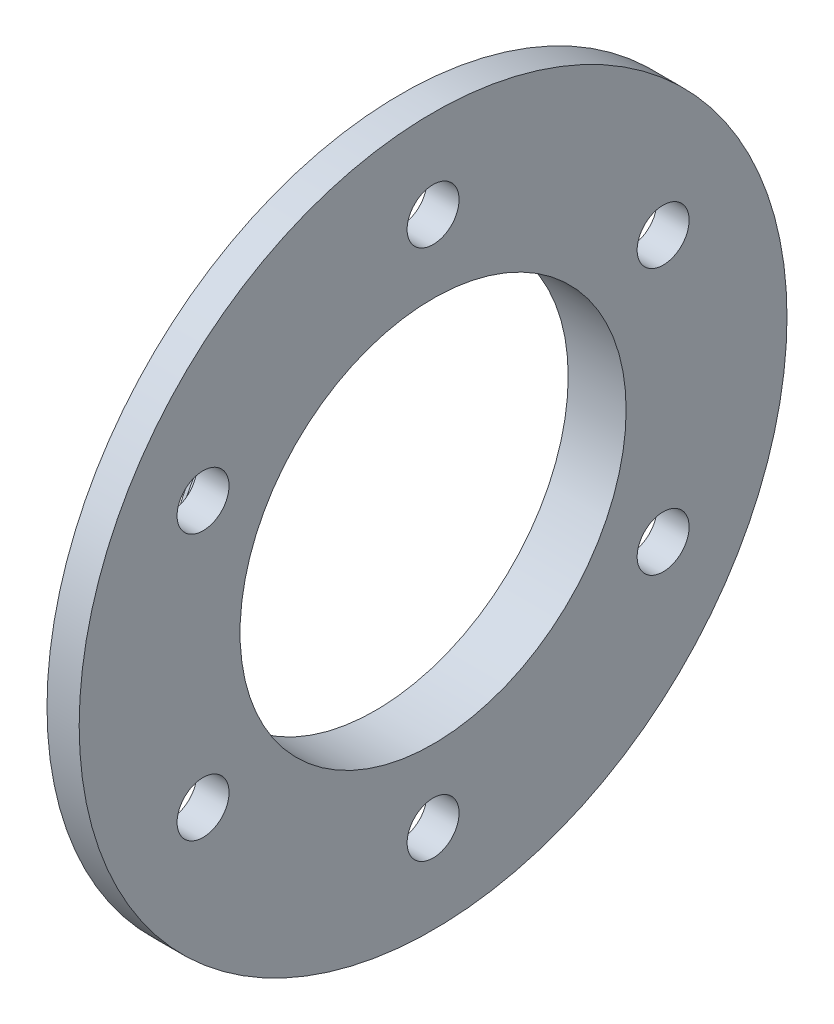
from build123d import *

# Parameters (mm, degrees)
SKETCH1_R           = 27.5
SKETCH1_R_2         = 2.0193
BOSS_EXTRUDE1_DEPTH = 2.5
SKETCH2_R           = 17.46
BOSS_EXTRUDE2_DEPTH = 2
CHAMFER5_SIZE       = 1
SKETCH6_R           = 15
CUT_EXTRUDE1_DEPTH  = 10


with BuildPart() as part:
    # Sketch1 → Boss-Extrude1 (new body)
    with BuildSketch(Plane(origin=(0, 0, 0), x_dir=(0, 0, -1), z_dir=(1, 0, 0))):
        Circle(SKETCH1_R)
        with Locations((0, 20.64)):
            Circle(SKETCH1_R_2, mode=Mode.SUBTRACT)
        with Locations((17.874764334, 10.32)):
            Circle(SKETCH1_R_2, mode=Mode.SUBTRACT)
        with Locations((17.874764334, -10.32)):
            Circle(SKETCH1_R_2, mode=Mode.SUBTRACT)
        with Locations((0, -20.64)):
            Circle(SKETCH1_R_2, mode=Mode.SUBTRACT)
        with Locations((-17.874764334, -10.32)):
            Circle(SKETCH1_R_2, mode=Mode.SUBTRACT)
        with Locations((-17.874764334, 10.32)):
            Circle(SKETCH1_R_2, mode=Mode.SUBTRACT)
    extrude(amount=BOSS_EXTRUDE1_DEPTH)

    # Sketch2 → Boss-Extrude2 (add)
    with BuildSketch(Plane.ZY):
        Circle(SKETCH2_R)
    extrude(amount=BOSS_EXTRUDE2_DEPTH)

    # Chamfer5
    chamfer5_edges = [part.edges().sort_by_distance(p)[0] for p in [
        (-2, 0, -17.46),
    ]]
    chamfer(chamfer5_edges, length=CHAMFER5_SIZE)

    # Sketch6 → Cut-Extrude1 (cut)
    with BuildSketch(Plane(origin=(-2, 0, 0), x_dir=(0, 0, -1), z_dir=(1, 0, 0))):
        Circle(SKETCH6_R)
    extrude(amount=CUT_EXTRUDE1_DEPTH, mode=Mode.SUBTRACT)


solid = part.part
